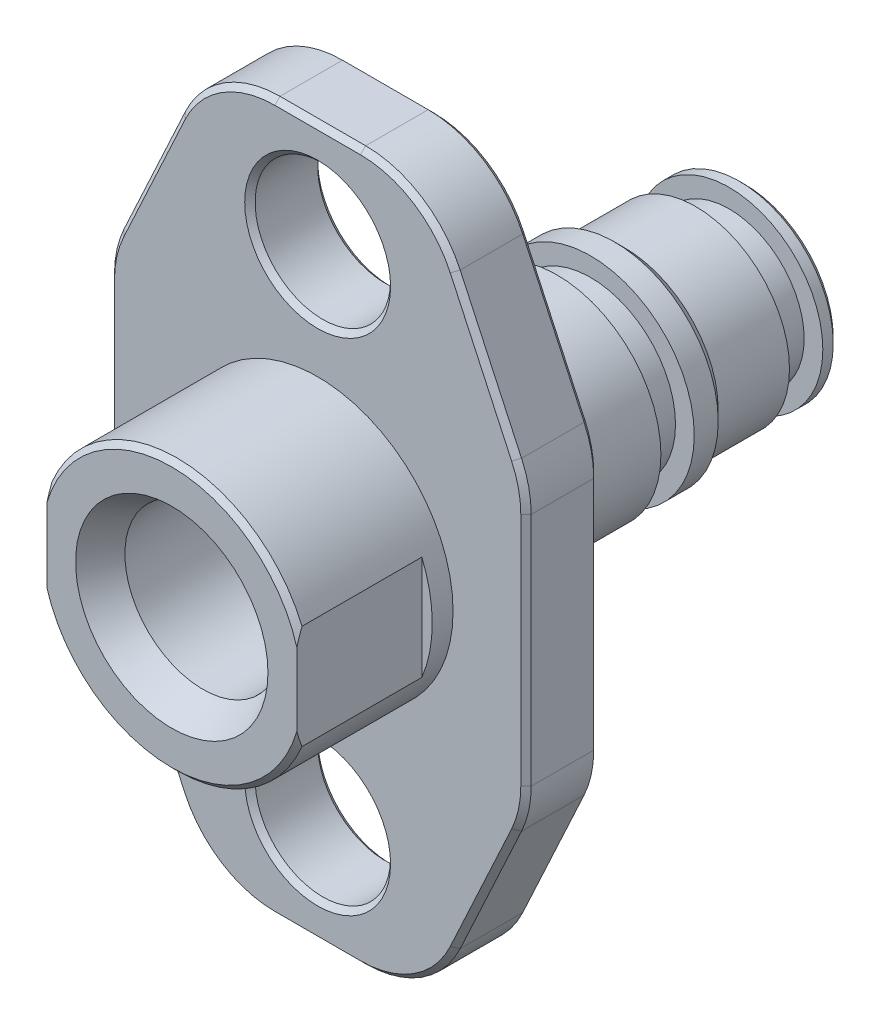
from build123d import *

# Parameters (mm, degrees)
SKETCH2_OUTSIDE_W  = 94.65
SKETCH2_OUTSIDE_H  = 94.65
SKETCH2_OUTSIDE_R  = 6.5
CUT_EXTRUDE1_DEPTH = 21
SKETCH5_W          = 2.091476768
SKETCH5_H          = 18
CUT_EXTRUDE2_DEPTH = 12
CIRPATTERN1_COUNT  = 2
CIRPATTERN1_ANGLE  = 180
CHAMFER1_SIZE      = 0.5


with BuildPart() as part:
    # Sketch1 → Revolve1 (revolve)
    with BuildSketch(Plane(origin=(0, 0, 0), x_dir=(0, 0, -1), z_dir=(1, 0, 0))):
        Polygon((14, 35), (21, 35), (21, 9.95), (37, 9.95), (37, 8.15), (40.2, 8.15), (40.2, 9.95), (42.5, 9.95), (43.46, 8.99), (50.3, 8.99), (50.3, 7.2), (53.5, 7.2), (53.5, 8.99), (54.5, 8.99), (55, 8.49), (55, 4.75), (18.652366702, 4.75), (17, 7.5), (3, 7.5), (0, 9.232050808), (0, 12.5), (0.5, 13), (14, 13), align=None)
    revolve(axis=Axis((0, 0, 0), (0, 0, -1)))

    # Sketch2 outside → Cut-Extrude1 (cut)
    # profile 1 of 3: a face of its own
    with BuildSketch(Plane.XY):
        Rectangle(SKETCH2_OUTSIDE_W, SKETCH2_OUTSIDE_H)
        with BuildLine():
            Line((-4.112562412, 34), (4.112562412, 34))
            ThreePointArc((4.112562412, 34), (9.495586596, 32.427517466), (13.185668477, 28.204610128))
            Line((13.185668477, 28.204610128), (19.073106065, 15.500139543))
            ThreePointArc((19.073106065, 15.500139543), (19.765527652, 13.448311261), (20, 11.295529415))
            Line((20, 11.295529415), (20, -11.295529415))
            ThreePointArc((20, -11.295529415), (19.765527652, -13.448311261), (19.073106065, -15.500139543))
            Line((19.073106065, -15.500139543), (13.185668477, -28.204610128))
            ThreePointArc((13.185668477, -28.204610128), (9.495586596, -32.427517466), (4.112562412, -34))
            Line((4.112562412, -34), (-4.112562412, -34))
            ThreePointArc((-4.112562412, -34), (-9.495586596, -32.427517466), (-13.185668477, -28.204610128))
            Line((-13.185668477, -28.204610128), (-19.073106065, -15.500139543))
            ThreePointArc((-19.073106065, -15.500139543), (-19.765527652, -13.448311261), (-20, -11.295529415))
            Line((-20, -11.295529415), (-20, 11.295529415))
            ThreePointArc((-20, 11.295529415), (-19.765527652, 13.448311261), (-19.073106065, 15.500139543))
            Line((-19.073106065, 15.500139543), (-13.185668477, 28.204610128))
            ThreePointArc((-13.185668477, 28.204610128), (-9.495586596, 32.427517466), (-4.112562412, 34))
        make_face(mode=Mode.SUBTRACT)
    # profile 2 of 3: a face of its own
    with BuildSketch(Plane.XY):
        with Locations((0, 24)):
            Circle(SKETCH2_OUTSIDE_R)
    # profile 3 of 3: a face of its own
    with BuildSketch(Plane.XY):
        with Locations((0, -24)):
            Circle(SKETCH2_OUTSIDE_R)
    extrude(amount=-CUT_EXTRUDE1_DEPTH, mode=Mode.SUBTRACT)

    # Sketch5 → Cut-Extrude2 (cut)
    with BuildSketch(Plane.XY):
        with Locations((-13.045738384, -0.152764218)):
            Rectangle(SKETCH5_W, SKETCH5_H)
    cut_extrude2 = extrude(amount=-CUT_EXTRUDE2_DEPTH, mode=Mode.SUBTRACT)

    # CirPattern1: Cut-Extrude2 ×2 about axis
    cirpattern1_axis = Axis((0, 0, 0), (0, 0, -1))
    for i in range(1, CIRPATTERN1_COUNT):
        add(cut_extrude2.rotate(cirpattern1_axis, i * CIRPATTERN1_ANGLE / (CIRPATTERN1_COUNT - 1)), mode=Mode.SUBTRACT)

    # Chamfer1
    chamfer1_edges = [part.edges().sort_by_distance(p)[0] for p in [
        (-6.5, -24, -14),
        (-6.5, -24, -21),
        (-6.5, 24, -14),
        (-6.5, 24, -21),
        (9.495586596, -32.427517466, -14),
        (0, -34, -14),
        (16.129387271, -21.852374836, -14),
        (-9.495586596, -32.427517466, -14),
        (19.765527652, -13.448311261, -14),
        (-16.129387271, -21.852374836, -14),
        (20, 0, -14),
        (-19.765527652, -13.448311261, -14),
        (19.765527652, 13.448311261, -14),
        (-20, 0, -14),
        (16.129387271, 21.852374836, -14),
        (-19.765527652, 13.448311261, -14),
        (9.495586596, 32.427517466, -14),
        (-16.129387271, 21.852374836, -14),
        (0, 34, -14),
        (-9.495586596, 32.427517466, -14),
        (-9.495586596, -32.427517466, -21),
        (0, -34, -21),
        (-16.129387271, -21.852374836, -21),
        (9.495586596, -32.427517466, -21),
        (-19.765527652, -13.448311261, -21),
        (16.129387271, -21.852374836, -21),
        (-20, 0, -21),
        (19.765527652, -13.448311261, -21),
        (-19.765527652, 13.448311261, -21),
        (20, 0, -21),
        (-16.129387271, 21.852374836, -21),
        (19.765527652, 13.448311261, -21),
        (-9.495586596, 32.427517466, -21),
        (16.129387271, 21.852374836, -21),
        (0, 34, -21),
        (9.495586596, 32.427517466, -21),
    ]]
    chamfer(chamfer1_edges, length=CHAMFER1_SIZE)


solid = part.part
